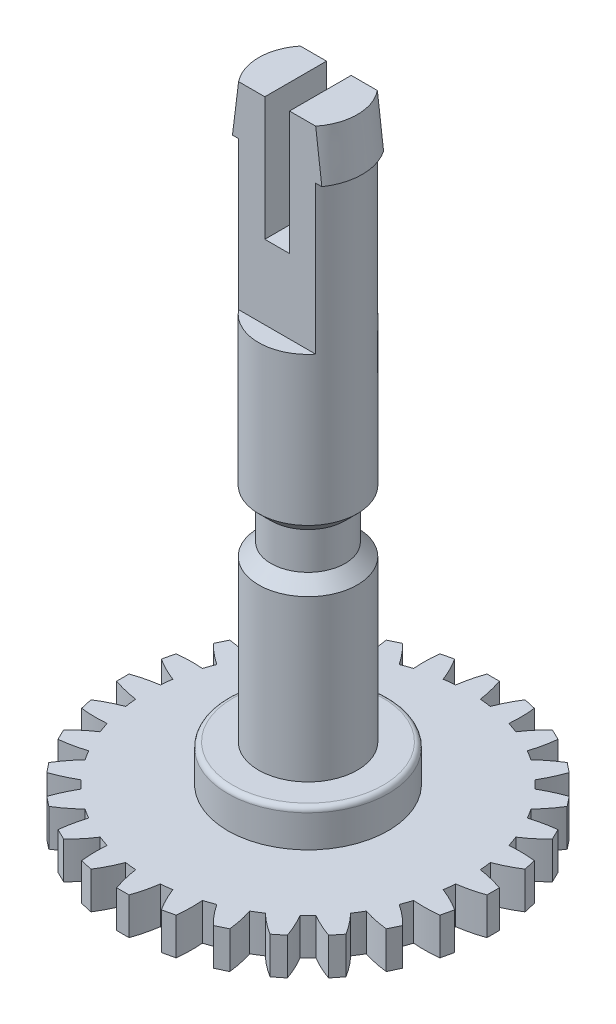
from build123d import *

# Parameters (mm, degrees)
SKETCH_1_R          = 6.5
EXTRUDE_1_DEPTH     = 1.5
SKETCH_2_R          = 3.25
EXTRUDE_2_DEPTH     = 1.5
SKETCH_3_R          = 2
EXTRUDE_3_DEPTH     = 23
CUT_EXTRUDE_START   = 8.5
SKETCH_4_R          = 2
SKETCH_4_R_2        = 1.5
CUT_EXTRUDE_1_DEPTH = 1.5
SKETCH_6_W          = 4.2
SKETCH_6_H          = 1
CUT_EXTRUDE_2_DEPTH = 8
CUT_EXTRUDE_3_REACH = 29.898
SKETCH_7_W          = 1
SKETCH_7_H          = 5
CHAMFER_1_SIZE      = 0.5
FILLET_1_R          = 0.2
EXTRUDE_4_DEPTH     = 1.5


with BuildPart() as part:
    # 草图1 → 凸台-拉伸1 (new body)
    with BuildSketch(Plane(origin=(0, 0, 0), x_dir=(1, 0, 0), z_dir=(0, 1, 0))):
        with Locations(Location((0, 0, 0), (0, 0, 270))):
            Circle(SKETCH_1_R)
    extrude(amount=EXTRUDE_1_DEPTH)

    # 草图2 → 凸台-拉伸2 (add)
    with BuildSketch(Plane(origin=(0, 1.5, 0), x_dir=(-1, 0, 0), z_dir=(0, 1, 0))):
        with Locations(Location((0, 0, 0), (0, 0, 90))):
            Circle(SKETCH_2_R)
    extrude(amount=EXTRUDE_2_DEPTH)

    # 草图3 → 凸台-拉伸3 (add)
    with BuildSketch(Plane(origin=(0, 3, 0), x_dir=(-1, 0, 0), z_dir=(0, 1, 0))):
        with Locations(Location((0, 0, 0), (0, 0, 90))):
            Circle(SKETCH_3_R)
    extrude(amount=EXTRUDE_3_DEPTH)

    # 草图4 → 切除-拉伸1 (cut)
    with BuildSketch(Plane(origin=(0, 1.5, 0), x_dir=(-1, 0, 0), z_dir=(0, 1, 0)).offset(CUT_EXTRUDE_START)):
        with Locations(Location((0, 0, 0), (0, 0, 90))):
            Circle(SKETCH_4_R)
        with Locations(Location((0, 0, 0), (0, 0, 90))):
            Circle(SKETCH_4_R_2, mode=Mode.SUBTRACT)
    extrude(amount=CUT_EXTRUDE_1_DEPTH, mode=Mode.SUBTRACT)

    # 草图5 → 旋转1 (revolve)
    with BuildSketch(Plane.XY, mode=Mode.PRIVATE) as revolve_1_sk:
        Polygon((0, 26), (0, 24), (2.2, 24), (2, 26), align=None)
    revolve(revolve_1_sk.sketch.rotate(Axis((0, 26, 0), (0, -1, 0)), 180), axis=Axis((0, 26, 0), (0, -1, 0)))

    # 草图6 → 切除-拉伸2 (cut)
    with BuildSketch(Plane(origin=(0, 26, 0), x_dir=(-1, 0, 0), z_dir=(0, 1, 0))):
        with Locations((0, -1.75)):
            Rectangle(SKETCH_6_W, SKETCH_6_H)
        with Locations((0, 1.75)):
            Rectangle(SKETCH_6_W, SKETCH_6_H)
    extrude(amount=-CUT_EXTRUDE_2_DEPTH, mode=Mode.SUBTRACT)

    # 草图7 → 切除-拉伸3 (cut, up to next)
    with BuildSketch(Plane.XY.offset(1.25), mode=Mode.PRIVATE) as cut_extrude_3_sk1:
        with Locations((0, 23.5)):
            Rectangle(SKETCH_7_W, SKETCH_7_H)
    cut_extrude_3_tool1 = extrude(cut_extrude_3_sk1.sketch, amount=-CUT_EXTRUDE_3_REACH, mode=Mode.PRIVATE) & part.part
    add(cut_extrude_3_tool1.solids().sort_by_distance((0, 23.5, 1.25))[0], mode=Mode.SUBTRACT)

    # 倒角1
    chamfer_1_edges = [part.edges().sort_by_distance(p)[0] for p in [
        (0, 11.5, -2),
        (0, 10, -2),
    ]]
    chamfer(chamfer_1_edges, length=CHAMFER_1_SIZE - 0.0001)  # a hair under: the kernel refuses the full size

    # 圆角1
    fillet_1_edges = [part.edges().sort_by_distance(p)[0] for p in [
        (0, 3, -3.25),
    ]]
    fillet(fillet_1_edges, radius=FILLET_1_R)

    # 草图9 → 凸台-拉伸4 (add)
    with BuildSketch(Plane.XZ):
        with BuildLine():
            Line((1.425175027, 7.367589575), (1.912638983, 7.256329108))
            ThreePointArc((1.912638983, 7.256329108), (1.9476736, 6.732090416), (1.929564429, 6.206994532))
            ThreePointArc((1.929564429, 6.206994532), (1.446386071, 6.337031429), (0.954636517, 6.429515465))
            ThreePointArc((0.954636517, 6.429515465), (1.166151284, 6.910467785), (1.425175027, 7.367589575))
        make_face()
        with BuildLine():
            Line((-0.25, 7.5), (0.25, 7.5))
            ThreePointArc((0.25, 7.5), (0.400810309, 6.996701003), (0.5, 6.480740698))
            ThreePointArc((0.5, 6.480740698), (0, 6.5), (-0.5, 6.480740698))
            ThreePointArc((-0.5, 6.480740698), (-0.400810309, 6.996701003), (-0.25, 7.5))
        make_face()
        with BuildLine():
            Line((3.028885826, 6.865737444), (3.47937026, 6.648795574))
            ThreePointArc((3.47937026, 6.648795574), (3.396872403, 6.129904706), (3.26237244, 5.622003741))
            ThreePointArc((3.26237244, 5.622003741), (2.820244304, 5.856297641), (2.361403573, 6.05588748))
            ThreePointArc((2.361403573, 6.05588748), (2.674637182, 6.477714857), (3.028885826, 6.865737444))
        make_face()
        with BuildLine():
            Line((4.480715643, 6.019608569), (4.871631385, 5.707863668))
            ThreePointArc((4.871631385, 5.707863668), (4.67573784, 5.220339977), (4.431591475, 4.755102207))
            ThreePointArc((4.431591475, 4.755102207), (4.052683712, 5.081904636), (3.649759993, 5.378592009))
            ThreePointArc((3.649759993, 5.378592009), (4.049005603, 5.720142258), (4.480715643, 6.019608569))
        make_face()
        with BuildLine():
            Line((5.707863668, 4.871631385), (6.019608569, 4.480715643))
            ThreePointArc((6.019608569, 4.480715643), (5.720142258, 4.049005603), (5.378592009, 3.649759993))
            ThreePointArc((5.378592009, 3.649759993), (5.081904636, 4.052683712), (4.755102207, 4.431591475))
            ThreePointArc((4.755102207, 4.431591475), (5.220339977, 4.67573784), (5.707863668, 4.871631385))
        make_face()
        with BuildLine():
            Line((6.648795574, 3.47937026), (6.865737444, 3.028885826))
            ThreePointArc((6.865737444, 3.028885826), (6.477714857, 2.674637182), (6.05588748, 2.361403573))
            ThreePointArc((6.05588748, 2.361403573), (5.856297641, 2.820244304), (5.622003741, 3.26237244))
            ThreePointArc((5.622003741, 3.26237244), (6.129904706, 3.396872403), (6.648795574, 3.47937026))
        make_face()
        with BuildLine():
            Line((7.256329108, 1.912638983), (7.367589575, 1.425175027))
            ThreePointArc((7.367589575, 1.425175027), (6.910467785, 1.166151284), (6.429515465, 0.954636517))
            ThreePointArc((6.429515465, 0.954636517), (6.337031429, 1.446386071), (6.206994532, 1.929564429))
            ThreePointArc((6.206994532, 1.929564429), (6.732090416, 1.9476736), (7.256329108, 1.912638983))
        make_face()
        with BuildLine():
            Line((7.5, 0.25), (7.5, -0.25))
            ThreePointArc((7.5, -0.25), (6.996701003, -0.400810309), (6.480740698, -0.5))
            ThreePointArc((6.480740698, -0.5), (6.5, 0), (6.480740698, 0.5))
            ThreePointArc((6.480740698, 0.5), (6.996701003, 0.400810309), (7.5, 0.25))
        make_face()
        with BuildLine():
            Line((7.367589575, -1.425175027), (7.256329108, -1.912638983))
            ThreePointArc((7.256329108, -1.912638983), (6.732090416, -1.9476736), (6.206994532, -1.929564429))
            ThreePointArc((6.206994532, -1.929564429), (6.337031429, -1.446386071), (6.429515465, -0.954636517))
            ThreePointArc((6.429515465, -0.954636517), (6.910467785, -1.166151284), (7.367589575, -1.425175027))
        make_face()
        with BuildLine():
            Line((6.865737444, -3.028885826), (6.648795574, -3.47937026))
            ThreePointArc((6.648795574, -3.47937026), (6.129904706, -3.396872403), (5.622003741, -3.26237244))
            ThreePointArc((5.622003741, -3.26237244), (5.856297641, -2.820244304), (6.05588748, -2.361403573))
            ThreePointArc((6.05588748, -2.361403573), (6.477714857, -2.674637182), (6.865737444, -3.028885826))
        make_face()
        with BuildLine():
            Line((6.019608569, -4.480715643), (5.707863668, -4.871631385))
            ThreePointArc((5.707863668, -4.871631385), (5.220339977, -4.67573784), (4.755102207, -4.431591475))
            ThreePointArc((4.755102207, -4.431591475), (5.081904636, -4.052683712), (5.378592009, -3.649759993))
            ThreePointArc((5.378592009, -3.649759993), (5.720142258, -4.049005603), (6.019608569, -4.480715643))
        make_face()
        with BuildLine():
            Line((4.871631385, -5.707863668), (4.480715643, -6.019608569))
            ThreePointArc((4.480715643, -6.019608569), (4.049005603, -5.720142258), (3.649759993, -5.378592009))
            ThreePointArc((3.649759993, -5.378592009), (4.052683712, -5.081904636), (4.431591475, -4.755102207))
            ThreePointArc((4.431591475, -4.755102207), (4.67573784, -5.220339977), (4.871631385, -5.707863668))
        make_face()
        with BuildLine():
            Line((3.47937026, -6.648795574), (3.028885826, -6.865737444))
            ThreePointArc((3.028885826, -6.865737444), (2.674637182, -6.477714857), (2.361403573, -6.05588748))
            ThreePointArc((2.361403573, -6.05588748), (2.820244304, -5.856297641), (3.26237244, -5.622003741))
            ThreePointArc((3.26237244, -5.622003741), (3.396872403, -6.129904706), (3.47937026, -6.648795574))
        make_face()
        with BuildLine():
            Line((1.912638983, -7.256329108), (1.425175027, -7.367589575))
            ThreePointArc((1.425175027, -7.367589575), (1.166151284, -6.910467785), (0.954636517, -6.429515465))
            ThreePointArc((0.954636517, -6.429515465), (1.446386071, -6.337031429), (1.929564429, -6.206994532))
            ThreePointArc((1.929564429, -6.206994532), (1.9476736, -6.732090416), (1.912638983, -7.256329108))
        make_face()
        with BuildLine():
            Line((0.25, -7.5), (-0.25, -7.5))
            ThreePointArc((-0.25, -7.5), (-0.400810309, -6.996701003), (-0.5, -6.480740698))
            ThreePointArc((-0.5, -6.480740698), (0, -6.5), (0.5, -6.480740698))
            ThreePointArc((0.5, -6.480740698), (0.400810309, -6.996701003), (0.25, -7.5))
        make_face()
        with BuildLine():
            Line((-1.425175027, -7.367589575), (-1.912638983, -7.256329108))
            ThreePointArc((-1.912638983, -7.256329108), (-1.9476736, -6.732090416), (-1.929564429, -6.206994532))
            ThreePointArc((-1.929564429, -6.206994532), (-1.446386071, -6.337031429), (-0.954636517, -6.429515465))
            ThreePointArc((-0.954636517, -6.429515465), (-1.166151284, -6.910467785), (-1.425175027, -7.367589575))
        make_face()
        with BuildLine():
            Line((-3.028885826, -6.865737444), (-3.47937026, -6.648795574))
            ThreePointArc((-3.47937026, -6.648795574), (-3.396872403, -6.129904706), (-3.26237244, -5.622003741))
            ThreePointArc((-3.26237244, -5.622003741), (-2.820244304, -5.856297641), (-2.361403573, -6.05588748))
            ThreePointArc((-2.361403573, -6.05588748), (-2.674637182, -6.477714857), (-3.028885826, -6.865737444))
        make_face()
        with BuildLine():
            Line((-4.480715643, -6.019608569), (-4.871631385, -5.707863668))
            ThreePointArc((-4.871631385, -5.707863668), (-4.67573784, -5.220339977), (-4.431591475, -4.755102207))
            ThreePointArc((-4.431591475, -4.755102207), (-4.052683712, -5.081904636), (-3.649759993, -5.378592009))
            ThreePointArc((-3.649759993, -5.378592009), (-4.049005603, -5.720142258), (-4.480715643, -6.019608569))
        make_face()
        with BuildLine():
            Line((-5.707863668, -4.871631385), (-6.019608569, -4.480715643))
            ThreePointArc((-6.019608569, -4.480715643), (-5.720142258, -4.049005603), (-5.378592009, -3.649759993))
            ThreePointArc((-5.378592009, -3.649759993), (-5.081904636, -4.052683712), (-4.755102207, -4.431591475))
            ThreePointArc((-4.755102207, -4.431591475), (-5.220339977, -4.67573784), (-5.707863668, -4.871631385))
        make_face()
        with BuildLine():
            Line((-6.648795574, -3.47937026), (-6.865737444, -3.028885826))
            ThreePointArc((-6.865737444, -3.028885826), (-6.477714857, -2.674637182), (-6.05588748, -2.361403573))
            ThreePointArc((-6.05588748, -2.361403573), (-5.856297641, -2.820244304), (-5.622003741, -3.26237244))
            ThreePointArc((-5.622003741, -3.26237244), (-6.129904706, -3.396872403), (-6.648795574, -3.47937026))
        make_face()
        with BuildLine():
            Line((-7.256329108, -1.912638983), (-7.367589575, -1.425175027))
            ThreePointArc((-7.367589575, -1.425175027), (-6.910467785, -1.166151284), (-6.429515465, -0.954636517))
            ThreePointArc((-6.429515465, -0.954636517), (-6.337031429, -1.446386071), (-6.206994532, -1.929564429))
            ThreePointArc((-6.206994532, -1.929564429), (-6.732090416, -1.9476736), (-7.256329108, -1.912638983))
        make_face()
        with BuildLine():
            Line((-7.5, -0.25), (-7.5, 0.25))
            ThreePointArc((-7.5, 0.25), (-6.996701003, 0.400810309), (-6.480740698, 0.5))
            ThreePointArc((-6.480740698, 0.5), (-6.5, 0), (-6.480740698, -0.5))
            ThreePointArc((-6.480740698, -0.5), (-6.996701003, -0.400810309), (-7.5, -0.25))
        make_face()
        with BuildLine():
            Line((-7.367589575, 1.425175027), (-7.256329108, 1.912638983))
            ThreePointArc((-7.256329108, 1.912638983), (-6.732090416, 1.9476736), (-6.206994532, 1.929564429))
            ThreePointArc((-6.206994532, 1.929564429), (-6.337031429, 1.446386071), (-6.429515465, 0.954636517))
            ThreePointArc((-6.429515465, 0.954636517), (-6.910467785, 1.166151284), (-7.367589575, 1.425175027))
        make_face()
        with BuildLine():
            Line((-6.865737444, 3.028885826), (-6.648795574, 3.47937026))
            ThreePointArc((-6.648795574, 3.47937026), (-6.129904706, 3.396872403), (-5.622003741, 3.26237244))
            ThreePointArc((-5.622003741, 3.26237244), (-5.856297641, 2.820244304), (-6.05588748, 2.361403573))
            ThreePointArc((-6.05588748, 2.361403573), (-6.477714857, 2.674637182), (-6.865737444, 3.028885826))
        make_face()
        with BuildLine():
            Line((-6.019608569, 4.480715643), (-5.707863668, 4.871631385))
            ThreePointArc((-5.707863668, 4.871631385), (-5.220339977, 4.67573784), (-4.755102207, 4.431591475))
            ThreePointArc((-4.755102207, 4.431591475), (-5.081904636, 4.052683712), (-5.378592009, 3.649759993))
            ThreePointArc((-5.378592009, 3.649759993), (-5.720142258, 4.049005603), (-6.019608569, 4.480715643))
        make_face()
        with BuildLine():
            Line((-4.871631385, 5.707863668), (-4.480715643, 6.019608569))
            ThreePointArc((-4.480715643, 6.019608569), (-4.049005603, 5.720142258), (-3.649759993, 5.378592009))
            ThreePointArc((-3.649759993, 5.378592009), (-4.052683712, 5.081904636), (-4.431591475, 4.755102207))
            ThreePointArc((-4.431591475, 4.755102207), (-4.67573784, 5.220339977), (-4.871631385, 5.707863668))
        make_face()
        with BuildLine():
            Line((-3.47937026, 6.648795574), (-3.028885826, 6.865737444))
            ThreePointArc((-3.028885826, 6.865737444), (-2.674637182, 6.477714857), (-2.361403573, 6.05588748))
            ThreePointArc((-2.361403573, 6.05588748), (-2.820244304, 5.856297641), (-3.26237244, 5.622003741))
            ThreePointArc((-3.26237244, 5.622003741), (-3.396872403, 6.129904706), (-3.47937026, 6.648795574))
        make_face()
        with BuildLine():
            Line((-1.912638983, 7.256329108), (-1.425175027, 7.367589575))
            ThreePointArc((-1.425175027, 7.367589575), (-1.166151284, 6.910467785), (-0.954636517, 6.429515465))
            ThreePointArc((-0.954636517, 6.429515465), (-1.446386071, 6.337031429), (-1.929564429, 6.206994532))
            ThreePointArc((-1.929564429, 6.206994532), (-1.9476736, 6.732090416), (-1.912638983, 7.256329108))
        make_face()
    extrude(amount=-EXTRUDE_4_DEPTH)

    # 草图10 → 切除-旋转2 (revolve, cut)
    with BuildSketch(Plane.XY, mode=Mode.PRIVATE) as cut_revolve_2_sk:
        Polygon((0, 0), (2.25, 0), (0, 1), align=None)
    revolve(cut_revolve_2_sk.sketch.rotate(Axis((0, 0, 0), (0, 1, 0)), 270), axis=Axis((0, 0, 0), (0, 1, 0)), mode=Mode.SUBTRACT)


solid = part.part
